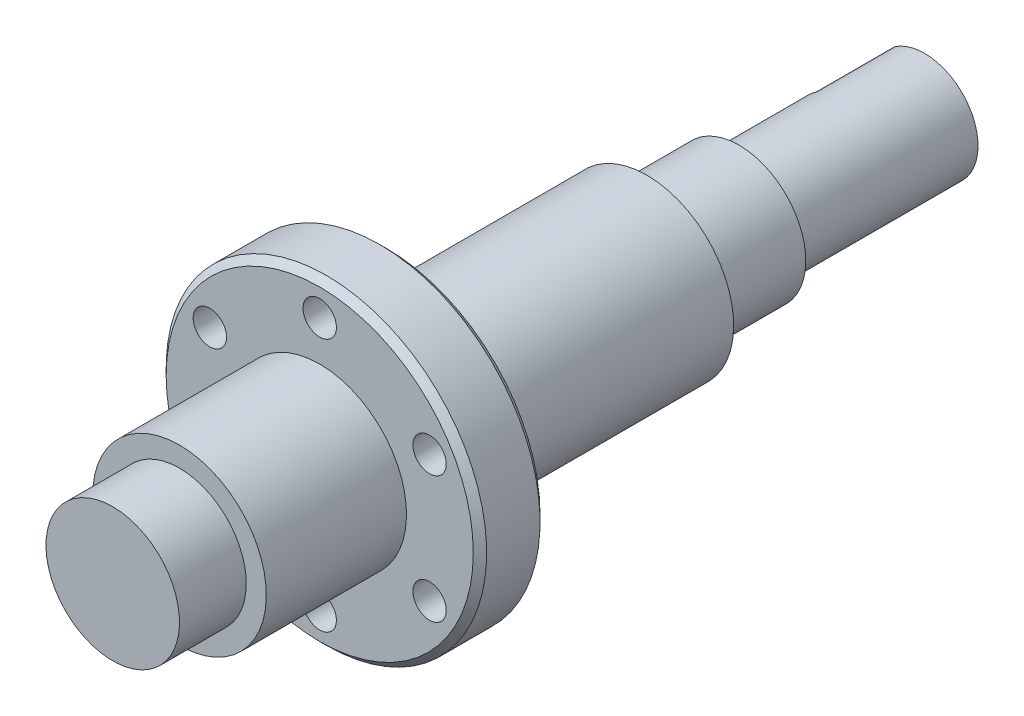
from build123d import *

# Parameters (mm, degrees)
HOLE_WIZARD_M3_1_D       = 2.5
PATTERN_CIRCULAR_1_COUNT = 6
CHAMFER_1_SIZE           = 0.5
SKETCH_5_OUTSIDE_W       = 38.908
SKETCH_5_OUTSIDE_H       = 38.908
SKETCH_5_OUTSIDE_R       = 4
CUT_EXTRUDE_1_DEPTH      = 8
EXTRUDE_START            = 5.9
EXTRUDE_1_DEPTH          = 5.9
HOLE_WIZARD_M3_2_D       = 2.5
HOLE_WIZARD_M3_2_DEPTH   = 7.5
HOLE_WIZARD_M3_2_TIP     = 0.7510757737844503
FILLET_1_R               = 1


with BuildPart() as part:
    # 草图1 → 旋转1 (revolve)
    with BuildSketch(Plane(origin=(0, 0, 0), x_dir=(0, 0, -1), z_dir=(1, 0, 0))):
        Polygon((0, 0), (0, 4.999999999999993), (5, 4.999999999999994), (5, 6.499999999999994), (15.5, 6.499999999999994), (15.5, 11.999999999999995), (20.5, 11.999999999999995), (20.5, 6.499999999999994), (40, 6.499999999999994), (40, 4.999999999999993), (54.900000000000006, 4.999999999999993), (54.900000000000006, 6.85e-15), align=None)
    revolve(axis=Axis((0, 6.85e-15, -54.900000000000006), (0, -1.2e-16, 1)))

    # M3 螺纹孔1 (through all)
    with Locations(Plane.XY.offset(-15.5)):
        with Locations((0, 9.5)):
            hole_wizard_m3_1 = Hole(HOLE_WIZARD_M3_1_D / 2)

    # 阵列(圆周)1: M3 螺纹孔1 ×6 about axis
    pattern_circular_1_axis = Axis((0, 6.85e-15, -54.900000000000006), (0, 1.2e-16, -1))
    for i in range(1, PATTERN_CIRCULAR_1_COUNT):
        add(hole_wizard_m3_1.rotate(pattern_circular_1_axis, i * 360 / PATTERN_CIRCULAR_1_COUNT), mode=Mode.SUBTRACT)

    # 倒角1
    chamfer_1_edges = [part.edges().sort_by_distance(p)[0] for p in [
        (-1.47e-15, -11.999999999999991, -15.500000000000002),
        (-1.47e-15, -11.999999999999991, -20.5),
    ]]
    chamfer(chamfer_1_edges, length=CHAMFER_1_SIZE)

    # 草图5 outside → 切除-拉伸1 (cut)
    with BuildSketch(Plane(origin=(0, 6.85e-15, -54.900000000000006), x_dir=(-1, 0, 0), z_dir=(0, 1.3e-16, -1))):
        Rectangle(SKETCH_5_OUTSIDE_W, SKETCH_5_OUTSIDE_H)
        Circle(SKETCH_5_OUTSIDE_R, mode=Mode.SUBTRACT)
    extrude(amount=-CUT_EXTRUDE_1_DEPTH, mode=Mode.SUBTRACT)

    # 草图6 → 凸台-拉伸1 (add)
    with BuildSketch(Plane(origin=(0, 6.85e-15, -54.900000000000006), x_dir=(-1, 0, 0), z_dir=(0, 1.2e-16, -1)).offset(EXTRUDE_START)):
        with BuildLine():
            Line((2.6000000000000005, 3.0397368307141326), (2.6000000000000005, -3.0397368307141326))
            ThreePointArc((2.6000000000000005, -3.0397368307141326), (-4, 4.9e-16), (2.6000000000000005, 3.0397368307141326))
        make_face()
    extrude(amount=-EXTRUDE_1_DEPTH)

    # M3 螺纹孔2
    with Locations(Plane(origin=(0, 7.58e-15, -60.800000000000004), x_dir=(-1, 0, 0), z_dir=(0, 1.2e-16, -1))):
        with Locations((0, 0)):
            Hole(HOLE_WIZARD_M3_2_D / 2, depth=HOLE_WIZARD_M3_2_DEPTH)
            with Locations((0, 0, -(HOLE_WIZARD_M3_2_DEPTH + HOLE_WIZARD_M3_2_TIP / 2))):  # 118° drill point
                Cone(0, HOLE_WIZARD_M3_2_D / 2, HOLE_WIZARD_M3_2_TIP, mode=Mode.SUBTRACT)

    # 圆角1
    fillet_1_edges = [part.edges().sort_by_distance(p)[0] for p in [
        (-2.6000000000000005, -3.0397368307141255, -57.85),
        (-2.6, 3.03973683071414, -57.85),
    ]]
    fillet(fillet_1_edges, radius=FILLET_1_R)


solid = part.part
